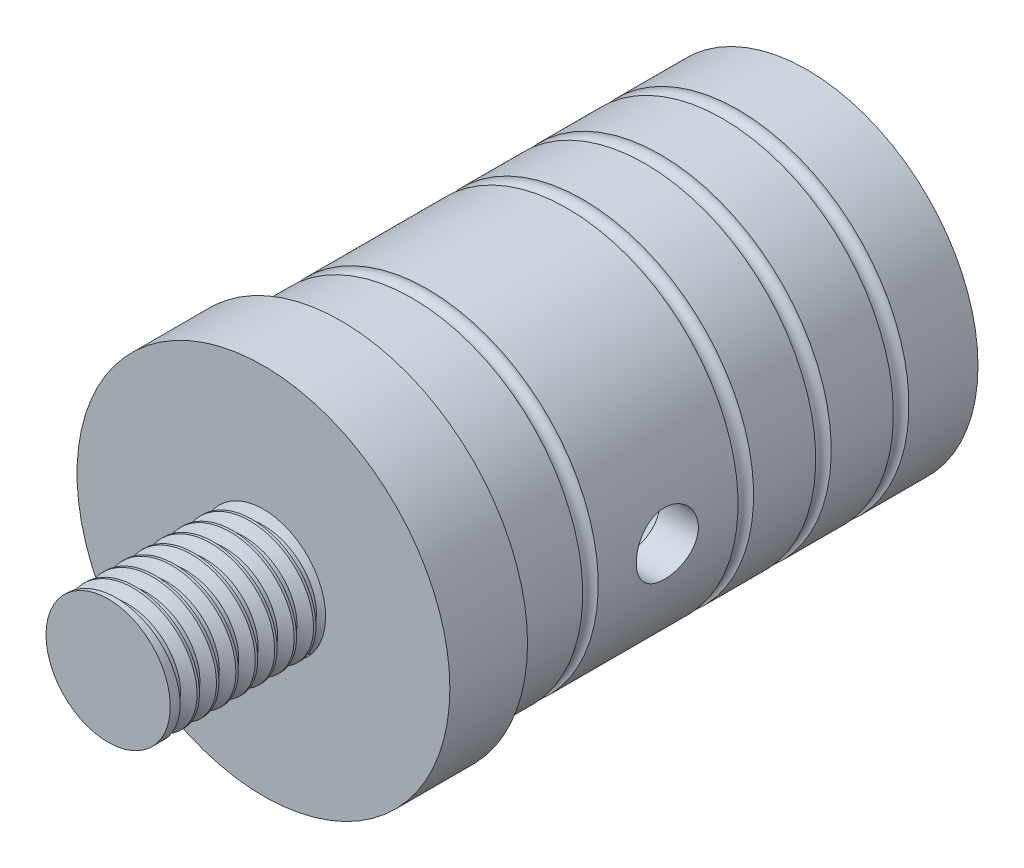
from build123d import *

# Parameters (mm, degrees)
IZIM1_R                     = 11
IZIM1_R_2                   = 8.5
Y_KSEKLIK_EKSTR_ZYON1_DEPTH = 30
IZIM2_R                     = 12
Y_KSEKLIK_EKSTR_ZYON2_DEPTH = 5
IZIM3_R                     = 4
Y_KSEKLIK_EKSTR_ZYON3_DEPTH = 10
SKETCH1_R                   = 0.5
CUT_EXTRUDE1_DEPTH          = 15
CUT_EXTRUDE1_DEPTH_BACK     = 15
SKETCH2_R                   = 2
THREAD1_PITCH               = 1.25


with BuildPart() as part:
    # Çizim1 → Yükseklik-Ekstrüzyon1 (new body)
    with BuildSketch(Plane.XY):
        Circle(IZIM1_R)
        Circle(IZIM1_R_2, mode=Mode.SUBTRACT)
    extrude(amount=Y_KSEKLIK_EKSTR_ZYON1_DEPTH)

    # Çizim2 → Yükseklik-Ekstrüzyon2 (add)
    with BuildSketch(Plane.XY.offset(30)):
        Circle(IZIM2_R)
    extrude(amount=Y_KSEKLIK_EKSTR_ZYON2_DEPTH)

    # Çizim3 → Yükseklik-Ekstrüzyon3 (add)
    with BuildSketch(Plane.XY.offset(35)):
        Circle(IZIM3_R)
    extrude(amount=Y_KSEKLIK_EKSTR_ZYON3_DEPTH)

    # Sketch1 → Cut-Revolve1 (revolve, cut)
    with BuildSketch(Plane(origin=(0, 0, 0), x_dir=(0, 0, -1), z_dir=(1, 0, 0))):
        with Locations((-24.947460506, 11)):
            Circle(SKETCH1_R)
        with Locations((-14.947460506, 11)):
            Circle(SKETCH1_R)
        with Locations((-9.947460506, 11)):
            Circle(SKETCH1_R)
        with Locations((-4.947460506, 11)):
            Circle(SKETCH1_R)
    revolve(axis=Axis((0, 0, -0.052539494), (0, 0, 1)), mode=Mode.SUBTRACT)

    # Sketch2 → Cut-Extrude1 (cut, two sides: drawn at the far end of the back side and taken through both)
    with BuildSketch(Plane(origin=(0, 0, 0), x_dir=(0, 0, -1), z_dir=(1, 0, 0)).offset(-CUT_EXTRUDE1_DEPTH_BACK)):
        with Locations(Location((-20, 0, 0), (0, 0, 180))):
            Circle(SKETCH2_R)
    extrude(amount=CUT_EXTRUDE1_DEPTH + CUT_EXTRUDE1_DEPTH_BACK, mode=Mode.SUBTRACT)

    # Thread1: the profile of Thread Profile1 profile screwed along a right-hand helix of 8 turns, 8 arcs to a turn; built about Z, then put on its axis
    thread1_z = Axis((0, 0, 0), (0, 0, 1))
    thread1_corners = [(4.0003, 0, -0.000173205), (4.0003, 0, 1.093923202), (3.323417656, 0, 0.703124998), (3.323417656, 0, 0.390624998)]
    with BuildLine(mode=Mode.PRIVATE) as thread1_profile:
        Line(thread1_corners[0], thread1_corners[1])
        Line(thread1_corners[1], thread1_corners[2])
        Line(thread1_corners[2], thread1_corners[3])
        Line(thread1_corners[3], thread1_corners[0])
    thread1_cap = Face(thread1_profile.wire())
    thread1_turn_angles = [0, 22.5, 45, 67.5, 90, 112.5, 135, 157.5, 180, 202.5, 225, 247.5, 270, 292.5, 315, 337.5, 360]
    thread1_turn_weights = [1, 0.9238795325112867, 1, 0.9238795325112867, 1, 0.9238795325112867, 1, 0.9238795325112867, 1, 0.9238795325112867, 1, 0.9238795325112867, 1, 0.9238795325112867, 1, 0.9238795325112867, 1]
    thread1_turn_rails = [Edge.make_bspline([Vector(p[0], p[1], 0).rotate(thread1_z, thread1_turn_angles[k]) / thread1_turn_weights[k] + Vector(0, 0, p[2] + THREAD1_PITCH * thread1_turn_angles[k] / 360) for k in range(17)], [0, 0, 0, 1, 1, 2, 2, 3, 3, 4, 4, 5, 5, 6, 6, 7, 7, 8, 8, 8], 2, thread1_turn_weights) for p in thread1_corners]
    thread1_turn_sides = [Face.make_surface_from_curves(thread1_turn_rails[p[0]], thread1_turn_rails[p[1]]) for p in [(0, 1), (1, 2), (2, 3), (3, 0)]]
    thread1 = Plane(origin=(0, 0, 45), x_dir=(-1, 0, 0), z_dir=(0, 0, -1)) * Solid(Shell([*[p.moved(Location((0, 0, THREAD1_PITCH * i))) for i in range(8) for p in thread1_turn_sides], thread1_cap, thread1_cap.rotate(thread1_z, 2880).moved(Location((0, 0, THREAD1_PITCH * 2880 / 360)))]))
    add(thread1, mode=Mode.SUBTRACT)


solid = part.part
